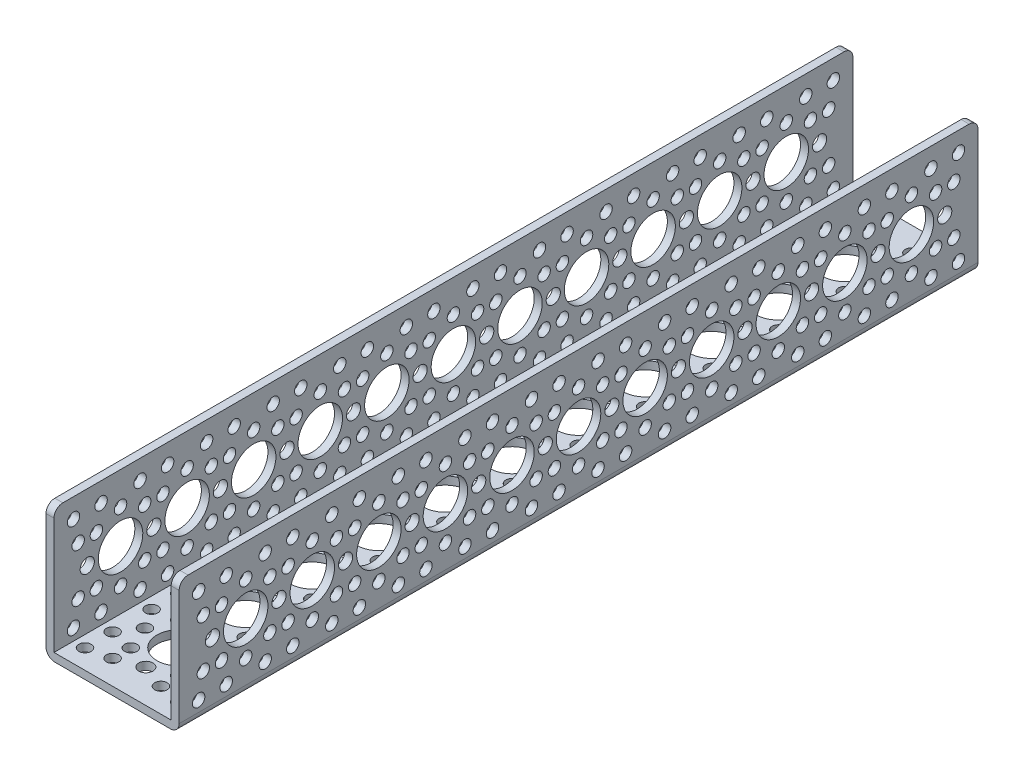
from build123d import *

# Parameters (mm, degrees)
SKETCH1_W                 = 228.6
SKETCH1_H                 = 38.1
BOSS_EXTRUDE1_DEPTH       = 38.1
SKETCH2_W                 = 33.528
SKETCH2_H                 = 35.814
CUT_EXTRUDE1_DEPTH        = 235.864173513
HOLE1_D                   = 12.7254
HOLE1_DEPTH               = 2.286
F_5_CLEARANCE_HOLE1_D     = 3.556
F_5_CLEARANCE_HOLE1_DEPTH = 2.286
F_6_CLEARANCE_HOLE1_D     = 4.064
F_6_CLEARANCE_HOLE1_DEPTH = 2.286
HOLE2_D                   = 12.7254
HOLE2_DEPTH               = 38.1
F_6_CLEARANCE_HOLE2_D     = 4.064
F_6_CLEARANCE_HOLE2_DEPTH = 38.1
F_5_CLEARANCE_HOLE2_D     = 3.556
F_5_CLEARANCE_HOLE2_DEPTH = 38.1
HOLE3_D                   = 12.7254
HOLE3_DEPTH               = 38.1
F_6_CLEARANCE_HOLE3_D     = 4.064
F_6_CLEARANCE_HOLE3_DEPTH = 38.1
F_5_CLEARANCE_HOLE3_D     = 3.556
F_5_CLEARANCE_HOLE3_DEPTH = 38.1
FILLET1_R                 = 2.54


with BuildPart() as part:
    # Sketch1 → Boss-Extrude1 (new body)
    with BuildSketch(Plane(origin=(38.1, 0, 0), x_dir=(0, 0, -1), z_dir=(1, 0, 0))):
        with Locations((-114.3, 19.05)):
            Rectangle(SKETCH1_W, SKETCH1_H)
    extrude(amount=-BOSS_EXTRUDE1_DEPTH)

    # Sketch2 → Cut-Extrude1 (cut, through all)
    with BuildSketch(Plane.XY.offset(228.6)):
        with Locations((19.05, 20.193)):
            Rectangle(SKETCH2_W, SKETCH2_H)
    extrude(amount=-CUT_EXTRUDE1_DEPTH, mode=Mode.SUBTRACT)

    # Hole1
    with Locations(Plane.ZY):
        with Locations((38.1, 19.05), (19.05, 19.05), (57.15, 19.05), (76.2, 19.05), (95.25, 19.05), (114.3, 19.05), (133.35, 19.05), (152.4, 19.05), (171.45, 19.05), (190.5, 19.05), (209.55, 19.05)):
            Hole(HOLE1_D / 2, depth=HOLE1_DEPTH)

    # #5 Clearance Hole1
    with Locations(Plane.ZY):
        with Locations((215.129615818, 5.579615818), (221.685202787, 12.135202787), (215.129615818, 32.520384182), (221.685202787, 25.964797213), (13.470384182, 5.579615818), (6.914797213, 12.135202787), (13.470384182, 32.520384182), (6.914797213, 25.964797213), (196.079615818, 5.579615818), (177.029615818, 5.579615818), (157.979615818, 5.579615818), (138.929615818, 5.579615818), (119.879615818, 5.579615818), (100.829615818, 5.579615818), (81.779615818, 5.579615818), (62.729615818, 5.579615818), (43.679615818, 5.579615818), (24.629615818, 5.579615818), (196.079615818, 32.520384182), (177.029615818, 32.520384182), (157.979615818, 32.520384182), (138.929615818, 32.520384182), (119.879615818, 32.520384182), (100.829615818, 32.520384182), (81.779615818, 32.520384182), (62.729615818, 32.520384182), (43.679615818, 32.520384182), (24.629615818, 32.520384182), (223.020384182, 5.579615818), (223.020384182, 32.520384182), (203.970384182, 5.579615818), (203.970384182, 32.520384182), (184.920384182, 5.579615818), (184.920384182, 32.520384182), (165.870384182, 5.579615818), (165.870384182, 32.520384182), (146.820384182, 5.579615818), (146.820384182, 32.520384182), (127.770384182, 5.579615818), (127.770384182, 32.520384182), (108.720384182, 5.579615818), (108.720384182, 32.520384182), (89.670384182, 5.579615818), (89.670384182, 32.520384182), (70.620384182, 5.579615818), (70.620384182, 32.520384182), (51.570384182, 5.579615818), (51.570384182, 32.520384182), (202.635202787, 12.135202787), (209.55, 9.271), (216.464797213, 12.135202787), (216.464797213, 25.964797213), (209.55, 28.829), (183.585202787, 12.135202787), (190.5, 9.271), (197.414797213, 12.135202787), (197.414797213, 25.964797213), (190.5, 28.829), (164.535202787, 12.135202787), (171.45, 9.271), (178.364797213, 12.135202787), (178.364797213, 25.964797213), (171.45, 28.829), (145.485202787, 12.135202787), (152.4, 9.271), (159.314797213, 12.135202787), (159.314797213, 25.964797213), (152.4, 28.829), (126.435202787, 12.135202787), (133.35, 9.271), (140.264797213, 12.135202787), (140.264797213, 25.964797213), (133.35, 28.829), (107.385202787, 12.135202787), (114.3, 9.271), (121.214797213, 12.135202787), (121.214797213, 25.964797213), (114.3, 28.829), (88.335202787, 12.135202787), (95.25, 9.271), (102.164797213, 12.135202787), (102.164797213, 25.964797213), (95.25, 28.829), (69.285202787, 12.135202787), (76.2, 9.271), (83.114797213, 12.135202787), (83.114797213, 25.964797213), (76.2, 28.829), (50.235202787, 12.135202787), (57.15, 9.271), (64.064797213, 12.135202787), (64.064797213, 25.964797213), (57.15, 28.829), (31.185202787, 12.135202787), (38.1, 9.271), (45.014797213, 12.135202787), (45.014797213, 25.964797213), (38.1, 28.829), (202.635202787, 25.964797213), (183.585202787, 25.964797213), (164.535202787, 25.964797213), (145.485202787, 25.964797213), (126.435202787, 25.964797213), (107.385202787, 25.964797213), (88.335202787, 25.964797213), (69.285202787, 25.964797213), (50.235202787, 25.964797213), (31.185202787, 25.964797213), (32.520384182, 5.579615818), (32.520384182, 32.520384182), (5.579615818, 5.579615818), (5.579615818, 32.520384182), (12.135202787, 12.135202787), (19.05, 9.271), (25.964797213, 12.135202787), (25.964797213, 25.964797213), (19.05, 28.829), (12.135202787, 25.964797213)):
            Hole(F_5_CLEARANCE_HOLE1_D / 2, depth=F_5_CLEARANCE_HOLE1_DEPTH)

    # #6 Clearance Hole1
    with Locations(Plane.ZY):
        with Locations((219.075, 19.05), (200.025, 19.05), (180.975, 19.05), (161.925, 19.05), (142.875, 19.05), (123.825, 19.05), (104.775, 19.05), (85.725, 19.05), (66.675, 19.05), (47.625, 19.05), (28.575, 19.05), (9.525, 19.05)):
            Hole(F_6_CLEARANCE_HOLE1_D / 2, depth=F_6_CLEARANCE_HOLE1_DEPTH)

    # Hole2
    with Locations(Plane(origin=(0, 0, 0), x_dir=(-1, 0, 0), z_dir=(0, -1, 0))):
        with Locations((-19.05, -209.55), (-19.05, -190.5), (-19.05, -171.45), (-19.05, -152.4), (-19.05, -133.35), (-19.05, -114.3), (-19.05, -95.25), (-19.05, -76.2), (-19.05, -57.15), (-19.05, -38.1), (-19.05, -19.05)):
            Hole(HOLE2_D / 2, depth=HOLE2_DEPTH)

    # #6 Clearance Hole2
    with Locations(Plane(origin=(0, 0, 0), x_dir=(-1, 0, 0), z_dir=(0, -1, 0))):
        with Locations((-19.05, -219.075), (-19.05, -200.025), (-19.05, -180.975), (-19.05, -161.925), (-19.05, -142.875), (-19.05, -123.825), (-19.05, -104.775), (-19.05, -85.725), (-19.05, -66.675), (-19.05, -47.625), (-19.05, -28.575), (-19.05, -9.525)):
            Hole(F_6_CLEARANCE_HOLE2_D / 2, depth=F_6_CLEARANCE_HOLE2_DEPTH)

    # #5 Clearance Hole2
    with Locations(Plane(origin=(0, 0, 0), x_dir=(-1, 0, 0), z_dir=(0, -1, 0))):
        with Locations((-5.579615818, -223.020384182), (-5.579615818, -215.129615818), (-12.135202787, -221.685202787), (-32.520384182, -223.020384182), (-32.520384182, -215.129615818), (-25.964797213, -221.685202787), (-5.579615818, -203.970384182), (-5.579615818, -196.079615818), (-32.520384182, -203.970384182), (-32.520384182, -196.079615818), (-5.579615818, -184.920384182), (-5.579615818, -177.029615818), (-32.520384182, -184.920384182), (-32.520384182, -177.029615818), (-5.579615818, -165.870384182), (-5.579615818, -157.979615818), (-32.520384182, -165.870384182), (-32.520384182, -157.979615818), (-5.579615818, -146.820384182), (-5.579615818, -138.929615818), (-32.520384182, -146.820384182), (-32.520384182, -138.929615818), (-5.579615818, -127.770384182), (-5.579615818, -119.879615818), (-32.520384182, -127.770384182), (-32.520384182, -119.879615818), (-5.579615818, -108.720384182), (-5.579615818, -100.829615818), (-32.520384182, -108.720384182), (-32.520384182, -100.829615818), (-5.579615818, -89.670384182), (-5.579615818, -81.779615818), (-32.520384182, -89.670384182), (-32.520384182, -81.779615818), (-5.579615818, -70.620384182), (-5.579615818, -62.729615818), (-32.520384182, -70.620384182), (-32.520384182, -62.729615818), (-5.579615818, -51.570384182), (-5.579615818, -43.679615818), (-32.520384182, -51.570384182), (-32.520384182, -43.679615818), (-12.135202787, -202.635202787), (-9.271, -209.55), (-12.135202787, -216.464797213), (-25.964797213, -216.464797213), (-28.829, -209.55), (-25.964797213, -202.635202787), (-12.135202787, -183.585202787), (-9.271, -190.5), (-12.135202787, -197.414797213), (-25.964797213, -197.414797213), (-28.829, -190.5), (-25.964797213, -183.585202787), (-12.135202787, -164.535202787), (-9.271, -171.45), (-12.135202787, -178.364797213), (-25.964797213, -178.364797213), (-28.829, -171.45), (-25.964797213, -164.535202787), (-12.135202787, -145.485202787), (-9.271, -152.4), (-12.135202787, -159.314797213), (-25.964797213, -159.314797213), (-28.829, -152.4), (-25.964797213, -145.485202787), (-12.135202787, -126.435202787), (-9.271, -133.35), (-12.135202787, -140.264797213), (-25.964797213, -140.264797213), (-28.829, -133.35), (-25.964797213, -126.435202787), (-12.135202787, -107.385202787), (-9.271, -114.3), (-12.135202787, -121.214797213), (-25.964797213, -121.214797213), (-28.829, -114.3), (-25.964797213, -107.385202787), (-12.135202787, -88.335202787), (-9.271, -95.25), (-12.135202787, -102.164797213), (-25.964797213, -102.164797213), (-28.829, -95.25), (-25.964797213, -88.335202787), (-12.135202787, -69.285202787), (-9.271, -76.2), (-12.135202787, -83.114797213), (-25.964797213, -83.114797213), (-28.829, -76.2), (-25.964797213, -69.285202787), (-12.135202787, -50.235202787), (-9.271, -57.15), (-12.135202787, -64.064797213), (-25.964797213, -64.064797213), (-28.829, -57.15), (-25.964797213, -50.235202787), (-9.271, -38.1), (-12.135202787, -45.014797213), (-25.964797213, -45.014797213), (-28.829, -38.1), (-5.579615818, -32.520384182), (-5.579615818, -24.629615818), (-12.135202787, -31.185202787), (-32.520384182, -32.520384182), (-32.520384182, -24.629615818), (-25.964797213, -31.185202787), (-5.579615818, -5.579615818), (-5.579615818, -13.470384182), (-12.135202787, -6.914797213), (-32.520384182, -5.579615818), (-32.520384182, -13.470384182), (-25.964797213, -6.914797213), (-12.135202787, -12.135202787), (-9.271, -19.05), (-12.135202787, -25.964797213), (-25.964797213, -25.964797213), (-28.829, -19.05), (-25.964797213, -12.135202787)):
            Hole(F_5_CLEARANCE_HOLE2_D / 2, depth=F_5_CLEARANCE_HOLE2_DEPTH)

    # Hole3
    with Locations(Plane(origin=(38.1, 0, 0), x_dir=(0, 0, -1), z_dir=(1, 0, 0))):
        with Locations((-38.1, 19.05), (-19.05, 19.05), (-57.15, 19.05), (-76.2, 19.05), (-95.25, 19.05), (-114.3, 19.05), (-133.35, 19.05), (-152.4, 19.05), (-171.45, 19.05), (-190.5, 19.05), (-209.55, 19.05)):
            Hole(HOLE3_D / 2, depth=HOLE3_DEPTH)

    # #6 Clearance Hole3
    with Locations(Plane(origin=(38.1, 0, 0), x_dir=(0, 0, -1), z_dir=(1, 0, 0))):
        with Locations((-200.025, 19.05), (-161.925, 19.05), (-123.825, 19.05), (-85.725, 19.05), (-47.625, 19.05), (-9.525, 19.05), (-28.575, 19.05), (-66.675, 19.05), (-104.775, 19.05), (-142.875, 19.05), (-180.975, 19.05), (-219.075, 19.05)):
            Hole(F_6_CLEARANCE_HOLE3_D / 2, depth=F_6_CLEARANCE_HOLE3_DEPTH)

    # #5 Clearance Hole3
    with Locations(Plane(origin=(38.1, 0, 0), x_dir=(0, 0, -1), z_dir=(1, 0, 0))):
        with Locations((-215.129615818, 5.579615818), (-215.129615818, 32.520384182), (-13.470384182, 5.579615818), (-196.079615818, 5.579615818), (-157.979615818, 5.579615818), (-119.879615818, 5.579615818), (-81.779615818, 5.579615818), (-43.679615818, 5.579615818), (-196.079615818, 32.520384182), (-157.979615818, 32.520384182), (-119.879615818, 32.520384182), (-81.779615818, 32.520384182), (-43.679615818, 32.520384182), (-223.020384182, 5.579615818), (-203.970384182, 5.579615818), (-184.920384182, 5.579615818), (-165.870384182, 5.579615818), (-146.820384182, 5.579615818), (-127.770384182, 5.579615818), (-108.720384182, 5.579615818), (-89.670384182, 5.579615818), (-70.620384182, 5.579615818), (-51.570384182, 5.579615818), (-209.55, 9.271), (-216.464797213, 25.964797213), (-183.585202787, 12.135202787), (-197.414797213, 12.135202787), (-190.5, 28.829), (-171.45, 9.271), (-178.364797213, 25.964797213), (-145.485202787, 12.135202787), (-159.314797213, 12.135202787), (-152.4, 28.829), (-133.35, 9.271), (-140.264797213, 25.964797213), (-107.385202787, 12.135202787), (-121.214797213, 12.135202787), (-114.3, 28.829), (-95.25, 9.271), (-102.164797213, 25.964797213), (-69.285202787, 12.135202787), (-83.114797213, 12.135202787), (-76.2, 28.829), (-57.15, 9.271), (-64.064797213, 25.964797213), (-31.185202787, 12.135202787), (-45.014797213, 12.135202787), (-38.1, 28.829), (-183.585202787, 25.964797213), (-145.485202787, 25.964797213), (-107.385202787, 25.964797213), (-69.285202787, 25.964797213), (-31.185202787, 25.964797213), (-12.135202787, 12.135202787), (-19.05, 9.271), (-25.964797213, 12.135202787), (-25.964797213, 25.964797213), (-19.05, 28.829), (-12.135202787, 25.964797213), (-5.579615818, 32.520384182), (-5.579615818, 5.579615818), (-32.520384182, 32.520384182), (-32.520384182, 5.579615818), (-50.235202787, 25.964797213), (-88.335202787, 25.964797213), (-126.435202787, 25.964797213), (-164.535202787, 25.964797213), (-202.635202787, 25.964797213), (-45.014797213, 25.964797213), (-38.1, 9.271), (-57.15, 28.829), (-64.064797213, 12.135202787), (-50.235202787, 12.135202787), (-83.114797213, 25.964797213), (-76.2, 9.271), (-95.25, 28.829), (-102.164797213, 12.135202787), (-88.335202787, 12.135202787), (-121.214797213, 25.964797213), (-114.3, 9.271), (-133.35, 28.829), (-140.264797213, 12.135202787), (-126.435202787, 12.135202787), (-159.314797213, 25.964797213), (-152.4, 9.271), (-171.45, 28.829), (-178.364797213, 12.135202787), (-164.535202787, 12.135202787), (-197.414797213, 25.964797213), (-190.5, 9.271), (-209.55, 28.829), (-216.464797213, 12.135202787), (-202.635202787, 12.135202787), (-51.570384182, 32.520384182), (-70.620384182, 32.520384182), (-89.670384182, 32.520384182), (-108.720384182, 32.520384182), (-127.770384182, 32.520384182), (-146.820384182, 32.520384182), (-165.870384182, 32.520384182), (-184.920384182, 32.520384182), (-203.970384182, 32.520384182), (-223.020384182, 32.520384182), (-24.629615818, 32.520384182), (-62.729615818, 32.520384182), (-100.829615818, 32.520384182), (-138.929615818, 32.520384182), (-177.029615818, 32.520384182), (-24.629615818, 5.579615818), (-62.729615818, 5.579615818), (-100.829615818, 5.579615818), (-138.929615818, 5.579615818), (-177.029615818, 5.579615818), (-6.914797213, 25.964797213), (-13.470384182, 32.520384182), (-6.914797213, 12.135202787), (-221.685202787, 25.964797213), (-221.685202787, 12.135202787)):
            Hole(F_5_CLEARANCE_HOLE3_D / 2, depth=F_5_CLEARANCE_HOLE3_DEPTH)

    # Fillet1
    fillet1_edges = [part.edges().sort_by_distance(p)[0] for p in [
        (0, 0, 114.3),
        (1.143, 38.1, 228.6),
        (1.143, 38.1, 0),
        (36.957, 38.1, 228.6),
        (36.957, 38.1, 0),
        (38.1, 0, 114.3),
    ]]
    fillet(fillet1_edges, radius=FILLET1_R)


solid = part.part
